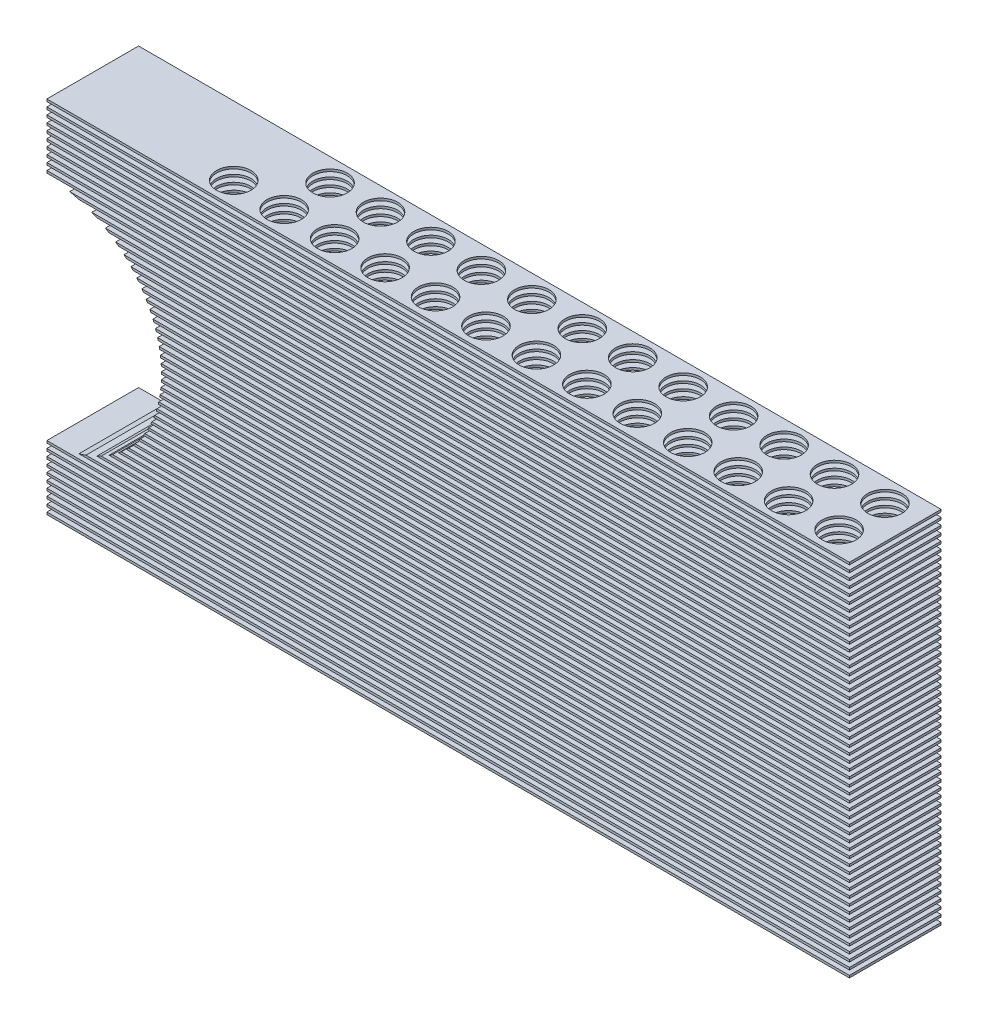
from build123d import *

# Parameters (mm, degrees)
CROQUIS2_W                 = 350
CROQUIS2_H                 = 1
SALIENTE_EXTRUIR2_DEPTH    = 40
SALIENTE_EXTRUIR2_2_DEPTH  = 40
SALIENTE_EXTRUIR2_3_DEPTH  = 40
SALIENTE_EXTRUIR2_4_DEPTH  = 40
SALIENTE_EXTRUIR2_5_DEPTH  = 40
SALIENTE_EXTRUIR2_6_DEPTH  = 40
SALIENTE_EXTRUIR2_7_DEPTH  = 40
SALIENTE_EXTRUIR2_8_DEPTH  = 40
SALIENTE_EXTRUIR2_9_DEPTH  = 40
SALIENTE_EXTRUIR2_10_DEPTH = 40
SALIENTE_EXTRUIR2_11_DEPTH = 40
SALIENTE_EXTRUIR2_12_DEPTH = 40
SALIENTE_EXTRUIR2_13_DEPTH = 40
SALIENTE_EXTRUIR2_14_DEPTH = 40
SALIENTE_EXTRUIR2_15_DEPTH = 40
SALIENTE_EXTRUIR2_16_DEPTH = 40
SALIENTE_EXTRUIR2_17_DEPTH = 40
SALIENTE_EXTRUIR2_18_DEPTH = 40
SALIENTE_EXTRUIR2_19_DEPTH = 40
SALIENTE_EXTRUIR2_20_DEPTH = 40
SALIENTE_EXTRUIR2_21_DEPTH = 40
SALIENTE_EXTRUIR2_22_DEPTH = 40
SALIENTE_EXTRUIR2_23_DEPTH = 40
SALIENTE_EXTRUIR2_24_DEPTH = 40
SALIENTE_EXTRUIR2_25_DEPTH = 40
SALIENTE_EXTRUIR2_26_DEPTH = 40
SALIENTE_EXTRUIR2_27_DEPTH = 40
SALIENTE_EXTRUIR2_28_DEPTH = 40
SALIENTE_EXTRUIR2_29_DEPTH = 40
SALIENTE_EXTRUIR2_30_DEPTH = 40
SALIENTE_EXTRUIR2_31_DEPTH = 40
SALIENTE_EXTRUIR2_32_DEPTH = 40
SALIENTE_EXTRUIR2_33_DEPTH = 40
SALIENTE_EXTRUIR2_34_DEPTH = 40
SALIENTE_EXTRUIR2_35_DEPTH = 40
SALIENTE_EXTRUIR2_36_DEPTH = 40
SALIENTE_EXTRUIR2_37_DEPTH = 40
SALIENTE_EXTRUIR2_38_DEPTH = 40
SALIENTE_EXTRUIR2_39_DEPTH = 40
SALIENTE_EXTRUIR2_40_DEPTH = 40
SALIENTE_EXTRUIR2_41_DEPTH = 40
SALIENTE_EXTRUIR2_42_DEPTH = 40
SALIENTE_EXTRUIR2_43_DEPTH = 40
SALIENTE_EXTRUIR2_44_DEPTH = 40
SALIENTE_EXTRUIR2_45_DEPTH = 40
SALIENTE_EXTRUIR2_46_DEPTH = 40
SALIENTE_EXTRUIR2_47_DEPTH = 40
SALIENTE_EXTRUIR2_48_DEPTH = 40
SALIENTE_EXTRUIR2_49_DEPTH = 40
SALIENTE_EXTRUIR2_50_DEPTH = 40
SALIENTE_EXTRUIR2_51_DEPTH = 40
SALIENTE_EXTRUIR2_52_DEPTH = 40
SALIENTE_EXTRUIR2_53_DEPTH = 40
CROQUIS3_R                 = 7.5
CORTAR_EXTRUIR1_DEPTH      = 180


with BuildPart() as part:
    # Croquis2 → Saliente-Extruir2 (new body)
    with BuildSketch(Plane.XY):
        with Locations((0, 74.5)):
            Rectangle(CROQUIS2_W, CROQUIS2_H)
    extrude(amount=SALIENTE_EXTRUIR2_DEPTH)


with BuildPart() as body_2:
    # Croquis2 → Saliente-Extruir2 2 (new body)
    with BuildSketch(Plane.XY):
        with Locations((0, 77.5)):
            Rectangle(CROQUIS2_W, CROQUIS2_H)
    extrude(amount=SALIENTE_EXTRUIR2_2_DEPTH)


with BuildPart() as body_3:
    # Croquis2 → Saliente-Extruir2 3 (new body)
    with BuildSketch(Plane.XY):
        with Locations((0, 71.5)):
            Rectangle(CROQUIS2_W, CROQUIS2_H)
    extrude(amount=SALIENTE_EXTRUIR2_3_DEPTH)


with BuildPart() as body_4:
    # Croquis2 → Saliente-Extruir2 4 (new body)
    with BuildSketch(Plane.XY):
        with Locations((0, 68.5)):
            Rectangle(CROQUIS2_W, CROQUIS2_H)
    extrude(amount=SALIENTE_EXTRUIR2_4_DEPTH)


with BuildPart() as body_5:
    # Croquis2 → Saliente-Extruir2 5 (new body)
    with BuildSketch(Plane.XY):
        with Locations((0, 65.5)):
            Rectangle(CROQUIS2_W, CROQUIS2_H)
    extrude(amount=SALIENTE_EXTRUIR2_5_DEPTH)


with BuildPart() as body_6:
    # Croquis2 → Saliente-Extruir2 6 (new body)
    with BuildSketch(Plane.XY):
        with Locations((0, 62.5)):
            Rectangle(CROQUIS2_W, CROQUIS2_H)
    extrude(amount=SALIENTE_EXTRUIR2_6_DEPTH)


with BuildPart() as body_7:
    # Croquis2 → Saliente-Extruir2 7 (new body)
    with BuildSketch(Plane.XY):
        with Locations((0, 59.5)):
            Rectangle(CROQUIS2_W, CROQUIS2_H)
    extrude(amount=SALIENTE_EXTRUIR2_7_DEPTH)


with BuildPart() as body_8:
    # Croquis2 → Saliente-Extruir2 8 (new body)
    with BuildSketch(Plane.XY):
        with Locations((0, 56.5)):
            Rectangle(CROQUIS2_W, CROQUIS2_H)
    extrude(amount=SALIENTE_EXTRUIR2_8_DEPTH)


with BuildPart() as body_9:
    # Croquis2 → Saliente-Extruir2 9 (new body)
    with BuildSketch(Plane.XY):
        with Locations((0, 53.5)):
            Rectangle(CROQUIS2_W, CROQUIS2_H)
    extrude(amount=SALIENTE_EXTRUIR2_9_DEPTH)


with BuildPart() as body_10:
    # Croquis2 → Saliente-Extruir2 10 (new body)
    with BuildSketch(Plane.XY):
        with Locations((0, 50.5)):
            Rectangle(CROQUIS2_W, CROQUIS2_H)
    extrude(amount=SALIENTE_EXTRUIR2_10_DEPTH)


with BuildPart() as body_11:
    # Croquis2 → Saliente-Extruir2 11 (new body)
    with BuildSketch(Plane.XY):
        with BuildLine():
            Line((-165.050125629, 48), (175, 48))
            Line((175, 48), (175, 47))
            Line((175, 47), (-161, 47))
            ThreePointArc((-161, 47), (-163.014628892, 47.542258697), (-165.050125629, 48))
        make_face()
    extrude(amount=SALIENTE_EXTRUIR2_11_DEPTH)


with BuildPart() as body_12:
    # Croquis2 → Saliente-Extruir2 12 (new body)
    with BuildSketch(Plane.XY):
        with BuildLine():
            Line((-155.404082058, 45), (175, 45))
            Line((175, 45), (175, 44))
            Line((175, 44), (-153.205505282, 44))
            ThreePointArc((-153.205505282, 44), (-154.298754505, 44.513277568), (-155.404082058, 45))
        make_face()
    extrude(amount=SALIENTE_EXTRUIR2_12_DEPTH)


with BuildPart() as body_13:
    # Croquis2 → Saliente-Extruir2 13 (new body)
    with BuildSketch(Plane.XY):
        with BuildLine():
            Line((-149.485298356, 42), (175, 42))
            Line((175, 42), (175, 41))
            Line((175, 41), (-147.870680067, 41))
            ThreePointArc((-147.870680067, 41), (-148.673240763, 41.507666933), (-149.485298356, 42))
        make_face()
    extrude(amount=SALIENTE_EXTRUIR2_13_DEPTH)


with BuildPart() as body_14:
    # Croquis2 → Saliente-Extruir2 14 (new body)
    with BuildSketch(Plane.XY):
        with BuildLine():
            Line((-145, 39), (175, 39))
            Line((175, 39), (175, 38))
            Line((175, 38), (-143.711024306, 38))
            ThreePointArc((-143.711024306, 38), (-144.351433387, 38.50525743), (-145, 39))
        make_face()
    extrude(amount=SALIENTE_EXTRUIR2_14_DEPTH)


with BuildPart() as body_15:
    # Croquis2 → Saliente-Extruir2 15 (new body)
    with BuildSketch(Plane.XY):
        with BuildLine():
            Line((-141.369656558, 36), (175, 36))
            Line((175, 36), (175, 35))
            Line((175, 35), (-140.301296854, 35))
            ThreePointArc((-140.301296854, 35), (-140.831818136, 35.503908669), (-141.369656558, 36))
        make_face()
    extrude(amount=SALIENTE_EXTRUIR2_15_DEPTH)


with BuildPart() as body_16:
    # Croquis2 → Saliente-Extruir2 16 (new body)
    with BuildSketch(Plane.XY):
        with BuildLine():
            Line((-138.33939444, 33), (175, 33))
            Line((175, 33), (175, 32))
            Line((175, 32), (-137.436720058, 32))
            ThreePointArc((-137.436720058, 32), (-137.884689214, 32.503040239), (-138.33939444, 33))
        make_face()
    extrude(amount=SALIENTE_EXTRUIR2_16_DEPTH)


with BuildPart() as body_17:
    # Croquis2 → Saliente-Extruir2 17 (new body)
    with BuildSketch(Plane.XY):
        with BuildLine():
            Line((-135.769909508, 30), (175, 30))
            Line((175, 30), (175, 29))
            Line((175, 29), (-135, 29))
            ThreePointArc((-135, 29), (-135.381799513, 29.50242925), (-135.769909508, 30))
        make_face()
    extrude(amount=SALIENTE_EXTRUIR2_17_DEPTH)


with BuildPart() as body_18:
    # Croquis2 → Saliente-Extruir2 18 (new body)
    with BuildSketch(Plane.XY):
        with BuildLine():
            Line((-133.575369646, 27), (175, 27))
            Line((175, 27), (175, 26))
            Line((175, 26), (-132.916749175, 26))
            ThreePointArc((-132.916749175, 26), (-133.243065788, 26.501971661), (-133.575369646, 27))
        make_face()
    extrude(amount=SALIENTE_EXTRUIR2_18_DEPTH)


with BuildPart() as body_19:
    # Croquis2 → Saliente-Extruir2 19 (new body)
    with BuildSketch(Plane.XY):
        with BuildLine():
            Line((-131.698729811, 24), (175, 24))
            Line((175, 24), (175, 23))
            Line((175, 23), (-131.136575601, 23))
            ThreePointArc((-131.136575601, 23), (-131.414784667, 23.50161228), (-131.698729811, 24))
        make_face()
    extrude(amount=SALIENTE_EXTRUIR2_19_DEPTH)


with BuildPart() as body_20:
    # Croquis2 → Saliente-Extruir2 20 (new body)
    with BuildSketch(Plane.XY):
        with BuildLine():
            Line((-130.100111359, 21), (175, 21))
            Line((175, 21), (175, 20))
            Line((175, 20), (-129.623794782, 20))
            ThreePointArc((-129.623794782, 20), (-129.859183873, 20.501319015), (-130.100111359, 21))
        make_face()
    extrude(amount=SALIENTE_EXTRUIR2_20_DEPTH)


with BuildPart() as body_21:
    # Croquis2 → Saliente-Extruir2 21 (new body)
    with BuildSketch(Plane.XY):
        with BuildLine():
            Line((-128.750675681, 18), (175, 18))
            Line((175, 18), (175, 17))
            Line((175, 17), (-128.352384841, 17))
            ThreePointArc((-128.352384841, 17), (-128.548839185, 17.501071831), (-128.750675681, 18))
        make_face()
    extrude(amount=SALIENTE_EXTRUIR2_21_DEPTH)


with BuildPart() as body_22:
    # Croquis2 → Saliente-Extruir2 22 (new body)
    with BuildSketch(Plane.XY):
        with BuildLine():
            Line((-127.629122871, 15), (175, 15))
            Line((175, 15), (175, 14))
            Line((175, 14), (-127.303039929, 14))
            ThreePointArc((-127.303039929, 14), (-127.463451772, 14.500857477), (-127.629122871, 15))
        make_face()
    extrude(amount=SALIENTE_EXTRUIR2_22_DEPTH)


with BuildPart() as body_23:
    # Croquis2 → Saliente-Extruir2 23 (new body)
    with BuildSketch(Plane.XY):
        with BuildLine():
            Line((-126.719569182, 12), (175, 12))
            Line((175, 12), (175, 11))
            Line((175, 11), (-126.461355602, 11))
            ThreePointArc((-126.461355602, 11), (-126.587880325, 11.500666725), (-126.719569182, 12))
        make_face()
    extrude(amount=SALIENTE_EXTRUIR2_23_DEPTH)


with BuildPart() as body_24:
    # Croquis2 → Saliente-Extruir2 24 (new body)
    with BuildSketch(Plane.XY):
        with BuildLine():
            Line((-126.010205144, 9), (175, 9))
            Line((175, 9), (175, 8))
            Line((175, 8), (-125.816669491, 8))
            ThreePointArc((-125.816669491, 8), (-125.910890862, 8.50049283), (-126.010205144, 9))
        make_face()
    extrude(amount=SALIENTE_EXTRUIR2_24_DEPTH)


with BuildPart() as body_25:
    # Croquis2 → Saliente-Extruir2 25 (new body)
    with BuildSketch(Plane.XY):
        with BuildLine():
            Line((-125.492424822, 6), (175, 6))
            Line((175, 6), (175, 5))
            Line((175, 5), (-125.361305416, 5))
            ThreePointArc((-125.361305416, 5), (-125.424343656, 5.500330613), (-125.492424822, 6))
        make_face()
    extrude(amount=SALIENTE_EXTRUIR2_25_DEPTH)


with BuildPart() as body_26:
    # Croquis2 → Saliente-Extruir2 26 (new body)
    with BuildSketch(Plane.XY):
        with BuildLine():
            Line((-125.160256822, 3), (175, 3))
            Line((175, 3), (175, 2))
            Line((175, 2), (-125.090081146, 2))
            ThreePointArc((-125.090081146, 2), (-125.122662773, 2.500175875), (-125.160256822, 3))
        make_face()
    extrude(amount=SALIENTE_EXTRUIR2_26_DEPTH)


with BuildPart() as body_27:
    # Croquis2 → Saliente-Extruir2 27 (new body)
    with BuildSketch(Plane.XY):
        with BuildLine():
            Line((-125.010001, 0), (175, 0))
            Line((175, 0), (175, -1))
            Line((175, -1), (-125, -1))
            ThreePointArc((-125, -1), (-125.002500313, -0.499974996), (-125.010001, 0))
        make_face()
    extrude(amount=SALIENTE_EXTRUIR2_27_DEPTH)


with BuildPart() as body_28:
    # Croquis2 → Saliente-Extruir2 28 (new body)
    with BuildSketch(Plane.XY):
        with BuildLine():
            Line((-125.040016013, -3), (175, -3))
            Line((175, -3), (175, -4))
            Line((175, -4), (-125.090081146, -4))
            ThreePointArc((-125.090081146, -4), (-125.062545386, -3.500125323), (-125.040016013, -3))
        make_face()
    extrude(amount=SALIENTE_EXTRUIR2_28_DEPTH)


with BuildPart() as body_29:
    # Croquis2 → Saliente-Extruir2 29 (new body)
    with BuildSketch(Plane.XY):
        with BuildLine():
            Line((-125.250628145, -6), (175, -6))
            Line((175, -6), (175, -7))
            Line((175, -7), (-125.361305416, -7))
            ThreePointArc((-125.361305416, -7), (-125.303451451, -6.50027839), (-125.250628145, -6))
        make_face()
    extrude(amount=SALIENTE_EXTRUIR2_29_DEPTH)


with BuildPart() as body_30:
    # Croquis2 → Saliente-Extruir2 30 (new body)
    with BuildSketch(Plane.XY):
        with BuildLine():
            Line((-125.644149283, -9), (175, -9))
            Line((175, -9), (175, -10))
            Line((175, -10), (-125.816669491, -10))
            ThreePointArc((-125.816669491, -10), (-125.72787239, -9.500437683), (-125.644149283, -9))
        make_face()
    extrude(amount=SALIENTE_EXTRUIR2_30_DEPTH)


with BuildPart() as body_31:
    # Croquis2 → Saliente-Extruir2 31 (new body)
    with BuildSketch(Plane.XY):
        with BuildLine():
            Line((-126.225006407, -12), (175, -12))
            Line((175, -12), (175, -13))
            Line((175, -13), (-126.461355602, -13))
            ThreePointArc((-126.461355602, -13), (-126.340612059, -12.500607168), (-126.225006407, -12))
        make_face()
    extrude(amount=SALIENTE_EXTRUIR2_31_DEPTH)


with BuildPart() as body_32:
    # Croquis2 → Saliente-Extruir2 32 (new body)
    with BuildSketch(Plane.XY):
        with BuildLine():
            Line((-127, -15), (175, -15))
            Line((175, -15), (175, -16))
            Line((175, -16), (-127.303039929, -16))
            ThreePointArc((-127.303039929, -16), (-127.148907623, -15.500791644), (-127, -15))
        make_face()
    extrude(amount=SALIENTE_EXTRUIR2_32_DEPTH)


with BuildPart() as body_33:
    # Croquis2 → Saliente-Extruir2 33 (new body)
    with BuildSketch(Plane.XY):
        with BuildLine():
            Line((-127.978728218, -18), (175, -18))
            Line((175, -18), (175, -19))
            Line((175, -19), (-128.352384841, -19))
            ThreePointArc((-128.352384841, -19), (-128.16288763, -18.500997252), (-127.978728218, -18))
        make_face()
    extrude(amount=SALIENTE_EXTRUIR2_33_DEPTH)


with BuildPart() as body_34:
    # Croquis2 → Saliente-Extruir2 34 (new body)
    with BuildSketch(Plane.XY):
        with BuildLine():
            Line((-129.17424305, -21), (175, -21))
            Line((175, -21), (175, -22))
            Line((175, -22), (-129.623794782, -22))
            ThreePointArc((-129.623794782, -22), (-129.396277829, -21.50123226), (-129.17424305, -21))
        make_face()
    extrude(amount=SALIENTE_EXTRUIR2_34_DEPTH)


with BuildPart() as body_35:
    # Croquis2 → Saliente-Extruir2 35 (new body)
    with BuildSketch(Plane.XY):
        with BuildLine():
            Line((-130.604054239, -24), (175, -24))
            Line((175, -24), (175, -25))
            Line((175, -25), (-131.136575601, -25))
            ThreePointArc((-131.136575601, -25), (-130.867482451, -24.501508351), (-130.604054239, -24))
        make_face()
    extrude(amount=SALIENTE_EXTRUIR2_35_DEPTH)


with BuildPart() as body_36:
    # Croquis2 → Saliente-Extruir2 36 (new body)
    with BuildSketch(Plane.XY):
        with BuildLine():
            Line((-132.291686992, -27), (175, -27))
            Line((175, -27), (175, -28))
            Line((175, -28), (-132.916749175, -28))
            ThreePointArc((-132.916749175, -28), (-132.601269779, -27.501842873), (-132.291686992, -27))
        make_face()
    extrude(amount=SALIENTE_EXTRUIR2_36_DEPTH)


with BuildPart() as body_37:
    # Croquis2 → Saliente-Extruir2 37 (new body)
    with BuildSketch(Plane.XY):
        with BuildLine():
            Line((-134.269176291, -30), (175, -30))
            Line((175, -30), (175, -31))
            Line((175, -31), (-135, -31))
            ThreePointArc((-135, -31), (-134.631491554, -30.502263063), (-134.269176291, -30))
        make_face()
    extrude(amount=SALIENTE_EXTRUIR2_37_DEPTH)


with BuildPart() as body_38:
    # Croquis2 → Saliente-Extruir2 38 (new body)
    with BuildSketch(Plane.XY):
        with BuildLine():
            Line((-136.581254575, -33), (175, -33))
            Line((175, -33), (175, -34))
            Line((175, -34), (-137.436720058, -34))
            ThreePointArc((-137.436720058, -34), (-137.005697207, -33.502814575), (-136.581254575, -33))
        make_face()
    extrude(amount=SALIENTE_EXTRUIR2_38_DEPTH)


with BuildPart() as body_39:
    # Croquis2 → Saliente-Extruir2 39 (new body)
    with BuildSketch(Plane.XY):
        with BuildLine():
            Line((-139.292857857, -36), (175, -36))
            Line((175, -36), (175, -37))
            Line((175, -37), (-140.301296854, -37))
            ThreePointArc((-140.301296854, -37), (-139.793526693, -36.503580627), (-139.292857857, -36))
        make_face()
    extrude(amount=SALIENTE_EXTRUIR2_39_DEPTH)


with BuildPart() as body_40:
    # Croquis2 → Saliente-Extruir2 40 (new body)
    with BuildSketch(Plane.XY):
        with BuildLine():
            Line((-142.503846381, -39), (175, -39))
            Line((175, -39), (175, -40))
            Line((175, -40), (-143.711024306, -40))
            ThreePointArc((-143.711024306, -40), (-143.103516176, -39.504731133), (-142.503846381, -39))
        make_face()
    extrude(amount=SALIENTE_EXTRUIR2_40_DEPTH)


with BuildPart() as body_41:
    # Croquis2 → Saliente-Extruir2 41 (new body)
    with BuildSketch(Plane.XY):
        with BuildLine():
            Line((-146.381823957, -42), (175, -42))
            Line((175, -42), (175, -43))
            Line((175, -43), (-147.870680067, -43))
            ThreePointArc((-147.870680067, -43), (-147.121767867, -42.506676248), (-146.381823957, -42))
        make_face()
    extrude(amount=SALIENTE_EXTRUIR2_41_DEPTH)


with BuildPart() as body_42:
    # Croquis2 → Saliente-Extruir2 42 (new body)
    with BuildSketch(Plane.XY):
        with BuildLine():
            Line((-151.251315826, -45), (175, -45))
            Line((175, -45), (175, -46))
            Line((175, -46), (-153.205505282, -46))
            ThreePointArc((-153.205505282, -46), (-152.222921919, -45.510725832), (-151.251315826, -45))
        make_face()
    extrude(amount=SALIENTE_EXTRUIR2_42_DEPTH)


with BuildPart() as body_43:
    # Croquis2 → Saliente-Extruir2 43 (new body)
    with BuildSketch(Plane.XY):
        with BuildLine():
            Line((-157.941277891, -48), (175, -48))
            Line((175, -48), (175, -49))
            Line((175, -49), (-161, -49))
            ThreePointArc((-161, -49), (-159.462591762, -48.524614099), (-157.941277891, -48))
        make_face()
    extrude(amount=SALIENTE_EXTRUIR2_43_DEPTH)


with BuildPart() as body_44:
    # Croquis2 → Saliente-Extruir2 44 (new body)
    with BuildSketch(Plane.XY):
        with Locations((0, -51.5)):
            Rectangle(CROQUIS2_W, CROQUIS2_H)
    extrude(amount=SALIENTE_EXTRUIR2_44_DEPTH)


with BuildPart() as body_45:
    # Croquis2 → Saliente-Extruir2 45 (new body)
    with BuildSketch(Plane.XY):
        with Locations((0, -54.5)):
            Rectangle(CROQUIS2_W, CROQUIS2_H)
    extrude(amount=SALIENTE_EXTRUIR2_45_DEPTH)


with BuildPart() as body_46:
    # Croquis2 → Saliente-Extruir2 46 (new body)
    with BuildSketch(Plane.XY):
        with Locations((0, -57.5)):
            Rectangle(CROQUIS2_W, CROQUIS2_H)
    extrude(amount=SALIENTE_EXTRUIR2_46_DEPTH)


with BuildPart() as body_47:
    # Croquis2 → Saliente-Extruir2 47 (new body)
    with BuildSketch(Plane.XY):
        with Locations((0, -60.5)):
            Rectangle(CROQUIS2_W, CROQUIS2_H)
    extrude(amount=SALIENTE_EXTRUIR2_47_DEPTH)


with BuildPart() as body_48:
    # Croquis2 → Saliente-Extruir2 48 (new body)
    with BuildSketch(Plane.XY):
        with Locations((0, -63.5)):
            Rectangle(CROQUIS2_W, CROQUIS2_H)
    extrude(amount=SALIENTE_EXTRUIR2_48_DEPTH)


with BuildPart() as body_49:
    # Croquis2 → Saliente-Extruir2 49 (new body)
    with BuildSketch(Plane.XY):
        with Locations((0, -66.5)):
            Rectangle(CROQUIS2_W, CROQUIS2_H)
    extrude(amount=SALIENTE_EXTRUIR2_49_DEPTH)


with BuildPart() as body_50:
    # Croquis2 → Saliente-Extruir2 50 (new body)
    with BuildSketch(Plane.XY):
        with Locations((0, -69.5)):
            Rectangle(CROQUIS2_W, CROQUIS2_H)
    extrude(amount=SALIENTE_EXTRUIR2_50_DEPTH)


with BuildPart() as body_51:
    # Croquis2 → Saliente-Extruir2 51 (new body)
    with BuildSketch(Plane.XY):
        with Locations((0, -72.5)):
            Rectangle(CROQUIS2_W, CROQUIS2_H)
    extrude(amount=SALIENTE_EXTRUIR2_51_DEPTH)


with BuildPart() as body_52:
    # Croquis2 → Saliente-Extruir2 52 (new body)
    with BuildSketch(Plane.XY):
        with Locations((0, -75.5)):
            Rectangle(CROQUIS2_W, CROQUIS2_H)
    extrude(amount=SALIENTE_EXTRUIR2_52_DEPTH)


with BuildPart() as body_53:
    # Croquis2 → Saliente-Extruir2 53 (new body)
    with BuildSketch(Plane.XY):
        with Locations((0, -78.5)):
            Rectangle(CROQUIS2_W, CROQUIS2_H)
    extrude(amount=SALIENTE_EXTRUIR2_53_DEPTH)


with BuildPart() as cortar_extruir1_tool:
    # Croquis3 → Cortar-Extruir1 (new body)
    with BuildSketch(Plane(origin=(0, 78, 0), x_dir=(1, 0, 0), z_dir=(0, 1, 0))):
        with Locations((160.5, -10)):
            Circle(CROQUIS3_R)
        with Locations((138.5, -10)):
            Circle(CROQUIS3_R)
        with Locations((116.5, -10)):
            Circle(CROQUIS3_R)
        with Locations((94.5, -10)):
            Circle(CROQUIS3_R)
        with Locations((72.5, -10)):
            Circle(CROQUIS3_R)
        with Locations((50.5, -10)):
            Circle(CROQUIS3_R)
        with Locations((28.5, -10)):
            Circle(CROQUIS3_R)
        with Locations((6.5, -10)):
            Circle(CROQUIS3_R)
        with Locations((-15.5, -10)):
            Circle(CROQUIS3_R)
        with Locations((-37.5, -10)):
            Circle(CROQUIS3_R)
        with Locations((-59.5, -10)):
            Circle(CROQUIS3_R)
        with Locations((-81.5, -10)):
            Circle(CROQUIS3_R)
        with Locations((138.5, -30)):
            Circle(CROQUIS3_R)
        with Locations((116.5, -30)):
            Circle(CROQUIS3_R)
        with Locations((94.5, -30)):
            Circle(CROQUIS3_R)
        with Locations((72.5, -30)):
            Circle(CROQUIS3_R)
        with Locations((50.5, -30)):
            Circle(CROQUIS3_R)
        with Locations((28.5, -30)):
            Circle(CROQUIS3_R)
        with Locations((6.5, -30)):
            Circle(CROQUIS3_R)
        with Locations((-15.5, -30)):
            Circle(CROQUIS3_R)
        with Locations((-37.5, -30)):
            Circle(CROQUIS3_R)
        with Locations((-59.5, -30)):
            Circle(CROQUIS3_R)
        with Locations((-81.5, -30)):
            Circle(CROQUIS3_R)
        with Locations((-103.5, -30)):
            Circle(CROQUIS3_R)
        with Locations((160.5, -30)):
            Circle(CROQUIS3_R)
    extrude(amount=-CORTAR_EXTRUIR1_DEPTH)


with BuildPart() as part_1:
    add(part.part)

    # Cortar-Extruir1: cut by cortar_extruir1_tool
    add(cortar_extruir1_tool.part, mode=Mode.SUBTRACT)


with BuildPart() as body_2_1:
    add(body_2.part)

    # Cortar-Extruir1: cut by cortar_extruir1_tool
    add(cortar_extruir1_tool.part, mode=Mode.SUBTRACT)


with BuildPart() as body_3_1:
    add(body_3.part)

    # Cortar-Extruir1: cut by cortar_extruir1_tool
    add(cortar_extruir1_tool.part, mode=Mode.SUBTRACT)


with BuildPart() as body_4_1:
    add(body_4.part)

    # Cortar-Extruir1: cut by cortar_extruir1_tool
    add(cortar_extruir1_tool.part, mode=Mode.SUBTRACT)


with BuildPart() as body_5_1:
    add(body_5.part)

    # Cortar-Extruir1: cut by cortar_extruir1_tool
    add(cortar_extruir1_tool.part, mode=Mode.SUBTRACT)


with BuildPart() as body_6_1:
    add(body_6.part)

    # Cortar-Extruir1: cut by cortar_extruir1_tool
    add(cortar_extruir1_tool.part, mode=Mode.SUBTRACT)


with BuildPart() as body_7_1:
    add(body_7.part)

    # Cortar-Extruir1: cut by cortar_extruir1_tool
    add(cortar_extruir1_tool.part, mode=Mode.SUBTRACT)


with BuildPart() as body_8_1:
    add(body_8.part)

    # Cortar-Extruir1: cut by cortar_extruir1_tool
    add(cortar_extruir1_tool.part, mode=Mode.SUBTRACT)


with BuildPart() as body_9_1:
    add(body_9.part)

    # Cortar-Extruir1: cut by cortar_extruir1_tool
    add(cortar_extruir1_tool.part, mode=Mode.SUBTRACT)


with BuildPart() as body_10_1:
    add(body_10.part)

    # Cortar-Extruir1: cut by cortar_extruir1_tool
    add(cortar_extruir1_tool.part, mode=Mode.SUBTRACT)


with BuildPart() as body_11_1:
    add(body_11.part)

    # Cortar-Extruir1: cut by cortar_extruir1_tool
    add(cortar_extruir1_tool.part, mode=Mode.SUBTRACT)


with BuildPart() as body_12_1:
    add(body_12.part)

    # Cortar-Extruir1: cut by cortar_extruir1_tool
    add(cortar_extruir1_tool.part, mode=Mode.SUBTRACT)


with BuildPart() as body_13_1:
    add(body_13.part)

    # Cortar-Extruir1: cut by cortar_extruir1_tool
    add(cortar_extruir1_tool.part, mode=Mode.SUBTRACT)


with BuildPart() as body_14_1:
    add(body_14.part)

    # Cortar-Extruir1: cut by cortar_extruir1_tool
    add(cortar_extruir1_tool.part, mode=Mode.SUBTRACT)


with BuildPart() as body_15_1:
    add(body_15.part)

    # Cortar-Extruir1: cut by cortar_extruir1_tool
    add(cortar_extruir1_tool.part, mode=Mode.SUBTRACT)


with BuildPart() as body_16_1:
    add(body_16.part)

    # Cortar-Extruir1: cut by cortar_extruir1_tool
    add(cortar_extruir1_tool.part, mode=Mode.SUBTRACT)


with BuildPart() as body_17_1:
    add(body_17.part)

    # Cortar-Extruir1: cut by cortar_extruir1_tool
    add(cortar_extruir1_tool.part, mode=Mode.SUBTRACT)


with BuildPart() as body_18_1:
    add(body_18.part)

    # Cortar-Extruir1: cut by cortar_extruir1_tool
    add(cortar_extruir1_tool.part, mode=Mode.SUBTRACT)


with BuildPart() as body_19_1:
    add(body_19.part)

    # Cortar-Extruir1: cut by cortar_extruir1_tool
    add(cortar_extruir1_tool.part, mode=Mode.SUBTRACT)


with BuildPart() as body_20_1:
    add(body_20.part)

    # Cortar-Extruir1: cut by cortar_extruir1_tool
    add(cortar_extruir1_tool.part, mode=Mode.SUBTRACT)


with BuildPart() as body_21_1:
    add(body_21.part)

    # Cortar-Extruir1: cut by cortar_extruir1_tool
    add(cortar_extruir1_tool.part, mode=Mode.SUBTRACT)


with BuildPart() as body_22_1:
    add(body_22.part)

    # Cortar-Extruir1: cut by cortar_extruir1_tool
    add(cortar_extruir1_tool.part, mode=Mode.SUBTRACT)


with BuildPart() as body_23_1:
    add(body_23.part)

    # Cortar-Extruir1: cut by cortar_extruir1_tool
    add(cortar_extruir1_tool.part, mode=Mode.SUBTRACT)


with BuildPart() as body_24_1:
    add(body_24.part)

    # Cortar-Extruir1: cut by cortar_extruir1_tool
    add(cortar_extruir1_tool.part, mode=Mode.SUBTRACT)


with BuildPart() as body_25_1:
    add(body_25.part)

    # Cortar-Extruir1: cut by cortar_extruir1_tool
    add(cortar_extruir1_tool.part, mode=Mode.SUBTRACT)


with BuildPart() as body_26_1:
    add(body_26.part)

    # Cortar-Extruir1: cut by cortar_extruir1_tool
    add(cortar_extruir1_tool.part, mode=Mode.SUBTRACT)


with BuildPart() as body_27_1:
    add(body_27.part)

    # Cortar-Extruir1: cut by cortar_extruir1_tool
    add(cortar_extruir1_tool.part, mode=Mode.SUBTRACT)


with BuildPart() as body_28_1:
    add(body_28.part)

    # Cortar-Extruir1: cut by cortar_extruir1_tool
    add(cortar_extruir1_tool.part, mode=Mode.SUBTRACT)


with BuildPart() as body_29_1:
    add(body_29.part)

    # Cortar-Extruir1: cut by cortar_extruir1_tool
    add(cortar_extruir1_tool.part, mode=Mode.SUBTRACT)


with BuildPart() as body_30_1:
    add(body_30.part)

    # Cortar-Extruir1: cut by cortar_extruir1_tool
    add(cortar_extruir1_tool.part, mode=Mode.SUBTRACT)


with BuildPart() as body_31_1:
    add(body_31.part)

    # Cortar-Extruir1: cut by cortar_extruir1_tool
    add(cortar_extruir1_tool.part, mode=Mode.SUBTRACT)


with BuildPart() as body_32_1:
    add(body_32.part)

    # Cortar-Extruir1: cut by cortar_extruir1_tool
    add(cortar_extruir1_tool.part, mode=Mode.SUBTRACT)


with BuildPart() as body_33_1:
    add(body_33.part)

    # Cortar-Extruir1: cut by cortar_extruir1_tool
    add(cortar_extruir1_tool.part, mode=Mode.SUBTRACT)


with BuildPart() as body_34_1:
    add(body_34.part)

    # Cortar-Extruir1: cut by cortar_extruir1_tool
    add(cortar_extruir1_tool.part, mode=Mode.SUBTRACT)


with BuildPart() as body_35_1:
    add(body_35.part)

    # Cortar-Extruir1: cut by cortar_extruir1_tool
    add(cortar_extruir1_tool.part, mode=Mode.SUBTRACT)


with BuildPart() as body_36_1:
    add(body_36.part)

    # Cortar-Extruir1: cut by cortar_extruir1_tool
    add(cortar_extruir1_tool.part, mode=Mode.SUBTRACT)


with BuildPart() as body_37_1:
    add(body_37.part)

    # Cortar-Extruir1: cut by cortar_extruir1_tool
    add(cortar_extruir1_tool.part, mode=Mode.SUBTRACT)


with BuildPart() as body_38_1:
    add(body_38.part)

    # Cortar-Extruir1: cut by cortar_extruir1_tool
    add(cortar_extruir1_tool.part, mode=Mode.SUBTRACT)


with BuildPart() as body_39_1:
    add(body_39.part)

    # Cortar-Extruir1: cut by cortar_extruir1_tool
    add(cortar_extruir1_tool.part, mode=Mode.SUBTRACT)


with BuildPart() as body_40_1:
    add(body_40.part)

    # Cortar-Extruir1: cut by cortar_extruir1_tool
    add(cortar_extruir1_tool.part, mode=Mode.SUBTRACT)


with BuildPart() as body_41_1:
    add(body_41.part)

    # Cortar-Extruir1: cut by cortar_extruir1_tool
    add(cortar_extruir1_tool.part, mode=Mode.SUBTRACT)


with BuildPart() as body_42_1:
    add(body_42.part)

    # Cortar-Extruir1: cut by cortar_extruir1_tool
    add(cortar_extruir1_tool.part, mode=Mode.SUBTRACT)


with BuildPart() as body_43_1:
    add(body_43.part)

    # Cortar-Extruir1: cut by cortar_extruir1_tool
    add(cortar_extruir1_tool.part, mode=Mode.SUBTRACT)


with BuildPart() as body_44_1:
    add(body_44.part)

    # Cortar-Extruir1: cut by cortar_extruir1_tool
    add(cortar_extruir1_tool.part, mode=Mode.SUBTRACT)


with BuildPart() as body_45_1:
    add(body_45.part)

    # Cortar-Extruir1: cut by cortar_extruir1_tool
    add(cortar_extruir1_tool.part, mode=Mode.SUBTRACT)


with BuildPart() as body_46_1:
    add(body_46.part)

    # Cortar-Extruir1: cut by cortar_extruir1_tool
    add(cortar_extruir1_tool.part, mode=Mode.SUBTRACT)


with BuildPart() as body_47_1:
    add(body_47.part)

    # Cortar-Extruir1: cut by cortar_extruir1_tool
    add(cortar_extruir1_tool.part, mode=Mode.SUBTRACT)


with BuildPart() as body_48_1:
    add(body_48.part)

    # Cortar-Extruir1: cut by cortar_extruir1_tool
    add(cortar_extruir1_tool.part, mode=Mode.SUBTRACT)


with BuildPart() as body_49_1:
    add(body_49.part)

    # Cortar-Extruir1: cut by cortar_extruir1_tool
    add(cortar_extruir1_tool.part, mode=Mode.SUBTRACT)


with BuildPart() as body_50_1:
    add(body_50.part)

    # Cortar-Extruir1: cut by cortar_extruir1_tool
    add(cortar_extruir1_tool.part, mode=Mode.SUBTRACT)


with BuildPart() as body_51_1:
    add(body_51.part)

    # Cortar-Extruir1: cut by cortar_extruir1_tool
    add(cortar_extruir1_tool.part, mode=Mode.SUBTRACT)


with BuildPart() as body_52_1:
    add(body_52.part)

    # Cortar-Extruir1: cut by cortar_extruir1_tool
    add(cortar_extruir1_tool.part, mode=Mode.SUBTRACT)


with BuildPart() as body_53_1:
    add(body_53.part)

    # Cortar-Extruir1: cut by cortar_extruir1_tool
    add(cortar_extruir1_tool.part, mode=Mode.SUBTRACT)


solid = Compound([part_1.part, body_2_1.part, body_3_1.part, body_4_1.part, body_5_1.part, body_6_1.part, body_7_1.part, body_8_1.part, body_9_1.part, body_10_1.part, body_11_1.part, body_12_1.part, body_13_1.part, body_14_1.part, body_15_1.part, body_16_1.part, body_17_1.part, body_18_1.part, body_19_1.part, body_20_1.part, body_21_1.part, body_22_1.part, body_23_1.part, body_24_1.part, body_25_1.part, body_26_1.part, body_27_1.part, body_28_1.part, body_29_1.part, body_30_1.part, body_31_1.part, body_32_1.part, body_33_1.part, body_34_1.part, body_35_1.part, body_36_1.part, body_37_1.part, body_38_1.part, body_39_1.part, body_40_1.part, body_41_1.part, body_42_1.part, body_43_1.part, body_44_1.part, body_45_1.part, body_46_1.part, body_47_1.part, body_48_1.part, body_49_1.part, body_50_1.part, body_51_1.part, body_52_1.part, body_53_1.part])
